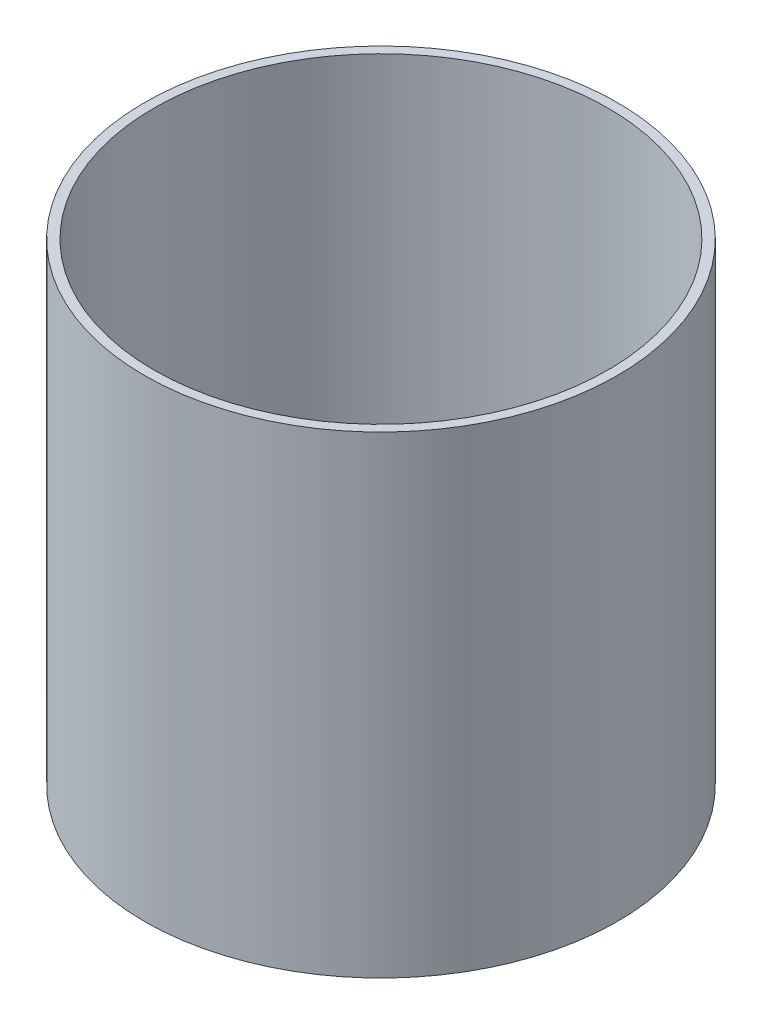
from build123d import *

# Parameters (mm, degrees)
SKETCH1_R           = 1250
SKETCH1_R_2         = 1200
BOSS_EXTRUDE1_DEPTH = 2500


with BuildPart() as part:
    # Sketch1 → Boss-Extrude1 (new body)
    with BuildSketch(Plane(origin=(0, 0, 0), x_dir=(1, 0, 0), z_dir=(0, 1, 0))):
        Circle(SKETCH1_R)
        Circle(SKETCH1_R_2, mode=Mode.SUBTRACT)
    extrude(amount=BOSS_EXTRUDE1_DEPTH)


solid = part.part
